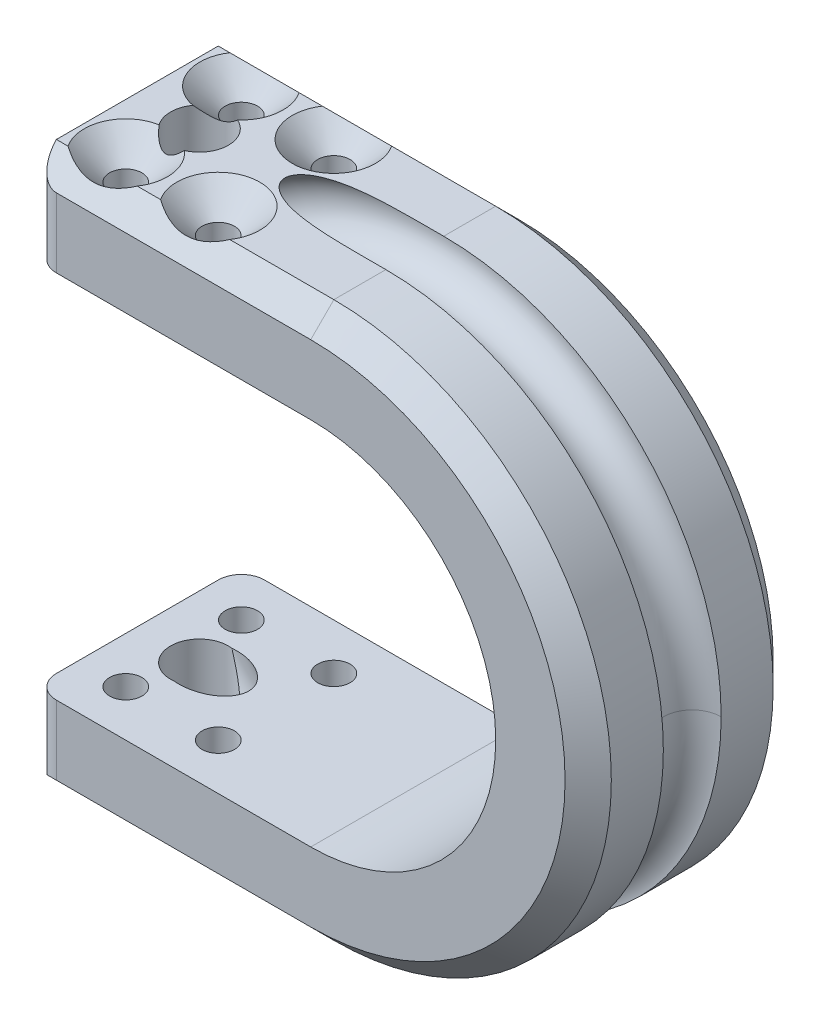
from build123d import *

# Parameters (mm, degrees)
BOSS_EXTRUDE1_DEPTH  = 4.5
CUT_SWEEP1_PROFILE_R = 1.25
SKETCH33_R           = 0.7
CUT_EXTRUDE1_DEPTH   = 28.20753587
CHAMFER1_SIZE        = 1
FILLET1_R            = 1
SKETCH35_R           = 1.25
CUT_EXTRUDE2_DEPTH   = 28.20753587


# Read off the part's stored shape, not the designer's step: CSK for M2 Flat Head Machine Screw1
with BuildPart() as part:
    # Sketch1 → Boss-Extrude1 (new, symmetric)
    with BuildSketch(Plane.XY):
        with BuildLine():
            Line((-9, 8), (0, 8))
            ThreePointArc((0, 8), (8, 0), (0, -8))
            Line((0, -8), (-9, -8))
            Line((-9, -8), (-12, -8))
            Line((-12, -8), (-12, -12))
            Line((-12, -12), (-9, -12))
            Line((-9, -12), (0, -12))
            ThreePointArc((0, -12), (12, 0), (0, 12))
            Line((0, 12), (-9, 12))
            Line((-9, 12), (-12, 12))
            Line((-12, 12), (-12, 8))
            Line((-12, 8), (-9, 8))
        make_face()
    extrude(amount=BOSS_EXTRUDE1_DEPTH, both=True)

    # Cut-Sweep1: sweep along a path in Sketch2
    with BuildLine(Plane.XY) as cut_sweep1_path:
        CenterArc((0, 0), 12, 0, 360)
    # Cut-Sweep1 profile (on start of the path) → Cut-Sweep1 (sweep, cut)
    with BuildSketch(Plane(origin=(12, 0, 0), x_dir=(0, 0, 1), z_dir=(0, 1, 0))):
        Circle(CUT_SWEEP1_PROFILE_R)
    sweep(path=cut_sweep1_path.line, mode=Mode.SUBTRACT)

    # Sketch33 → Cut-Extrude1 (cut, through all)
    with BuildSketch(Plane(origin=(0, 12, 0), x_dir=(1, 0, 0), z_dir=(0, 1, 0))):
        with Locations(Location((-10, 2.5, 0), (0, 0, 180))):
            Circle(SKETCH33_R)
        with Locations(Location((-10, -2.5, 0), (0, 0, 180))):
            Circle(SKETCH33_R)
        with Locations(Location((-6, 2.5, 0), (0, 0, 180))):
            Circle(SKETCH33_R)
        with Locations(Location((-6, -2.5, 0), (0, 0, 180))):
            Circle(SKETCH33_R)
    extrude(amount=-CUT_EXTRUDE1_DEPTH, mode=Mode.SUBTRACT)

    # CSK for M2 Flat Head Machine Screw1 outl → CSK for M2 Flat Head Machine Screw1 (revolve, cut)
    with BuildSketch(Plane(origin=(-6, 0, -2.5), x_dir=(1, 0, 0), z_dir=(0, 0, 1))):
        Polygon((1.8, -12), (0.7, -10.9), (0.7, -12), align=None)
        Polygon((0.7, 12), (0.7, 10.9), (1.8, 12), align=None)
    revolve(axis=Axis((-6, 0, -2.5), (0, 1, 0)), mode=Mode.SUBTRACT)

    # CSK for M2 Flat Head Machine Screw1 2 ou → CSK for M2 Flat Head Machine Screw1 2 (revolve, cut)
    with BuildSketch(Plane(origin=(-10, 0, -2.5), x_dir=(1, 0, 0), z_dir=(0, 0, 1))):
        Polygon((1.8, -12), (0.7, -10.9), (0.7, -12), align=None)
        Polygon((0.7, 12), (0.7, 10.9), (1.8, 12), align=None)
    revolve(axis=Axis((-10, 0, -2.5), (0, 1, 0)), mode=Mode.SUBTRACT)

    # CSK for M2 Flat Head Machine Screw1 3 ou → CSK for M2 Flat Head Machine Screw1 3 (revolve, cut)
    with BuildSketch(Plane(origin=(-6, 0, 2.5), x_dir=(1, 0, 0), z_dir=(0, 0, 1))):
        Polygon((1.8, -12), (0.7, -10.9), (0.7, -12), align=None)
        Polygon((0.7, 12), (0.7, 10.9), (1.8, 12), align=None)
    revolve(axis=Axis((-6, 0, 2.5), (0, 1, 0)), mode=Mode.SUBTRACT)

    # CSK for M2 Flat Head Machine Screw1 4 ou → CSK for M2 Flat Head Machine Screw1 4 (revolve, cut)
    with BuildSketch(Plane(origin=(-10, 0, 2.5), x_dir=(1, 0, 0), z_dir=(0, 0, 1))):
        Polygon((1.8, -12), (0.7, -10.9), (0.7, -12), align=None)
        Polygon((0.7, 12), (0.7, 10.9), (1.8, 12), align=None)
    revolve(axis=Axis((-10, 0, 2.5), (0, 1, 0)), mode=Mode.SUBTRACT)

    # Chamfer1
    # the kernel refuses this chamfer: 1 mm, written as the material it takes off along each edge
    with BuildSketch(Plane(origin=(0, 12, -4.5), x_dir=(0, 0.027495876610585623, 0.9996219169112968), z_dir=(-1, 0, 0)), Plane(origin=(0, -12, -4.5), x_dir=(0, 0.9996219169112968, -0.02749587661058651), z_dir=(-1, 0, 0)), Plane(origin=(-14.571682988, 12, 4.5), x_dir=(0, 0.027495876610585623, -0.9996219169112968), z_dir=(1, 0, 0))) as chamfer1_piece_1:
        Polygon((CHAMFER1_SIZE * 0.999621916911, -CHAMFER1_SIZE * 0.0274958766106), (-CHAMFER1_SIZE * 0.0274958766106, -CHAMFER1_SIZE * 0.999621916911), (0, 0), align=None)
    extrude(amount=14.571682988, mode=Mode.SUBTRACT)
    with BuildSketch(Plane(origin=(0, 0, -4.5), x_dir=(0, -1, 0), z_dir=(-1, 0, 0))) as chamfer1_piece_2:
        Polygon((12, CHAMFER1_SIZE), (12 - CHAMFER1_SIZE, 0), (12, 0), align=None)
    revolve(axis=Axis((0, 0, -4.5), (0, 0, 1)), revolution_arc=180, mode=Mode.SUBTRACT)
    with BuildSketch(Plane(origin=(0, -12, 4.5), x_dir=(0, 0.9996219169112968, 0.02749587661058651), z_dir=(-1, 0, 0))) as chamfer1_piece_3:
        Polygon((CHAMFER1_SIZE * 0.999621916911, CHAMFER1_SIZE * 0.0274958766106), (-CHAMFER1_SIZE * 0.0274958766106, CHAMFER1_SIZE * 0.999621916911), (0, 0), align=None)
    extrude(amount=14.571682988, mode=Mode.SUBTRACT)
    with BuildSketch(Plane(origin=(0, 0, 4.5), x_dir=(0, -1, 0), z_dir=(-1, 0, 0))) as chamfer1_piece_4:
        Polygon((12, -CHAMFER1_SIZE), (12 - CHAMFER1_SIZE, 0), (12, 0), align=None)
    revolve(axis=Axis((0, 0, 4.5), (0, 0, 1)), revolution_arc=180, mode=Mode.SUBTRACT)

    # Fillet1
    fillet1_edges = [part.edges().sort_by_distance(p)[0] for p in [
        (-12, 9.5, -4.5),
        (-12, -9.5, -4.5),
        (-12, -9.5, 4.5),
        (-12, 9.5, 4.5),
    ]]
    fillet(fillet1_edges, radius=FILLET1_R)

    # Sketch35 → Cut-Extrude2 (cut, through all)
    with BuildSketch(Plane(origin=(0, 12, 0), x_dir=(1, 0, 0), z_dir=(0, 1, 0))):
        with Locations(Location((-9.312227725, 0, 0), (0, 0, 178.657120172))):
            Circle(SKETCH35_R)
    extrude(amount=-CUT_EXTRUDE2_DEPTH, mode=Mode.SUBTRACT)


solid = part.part
